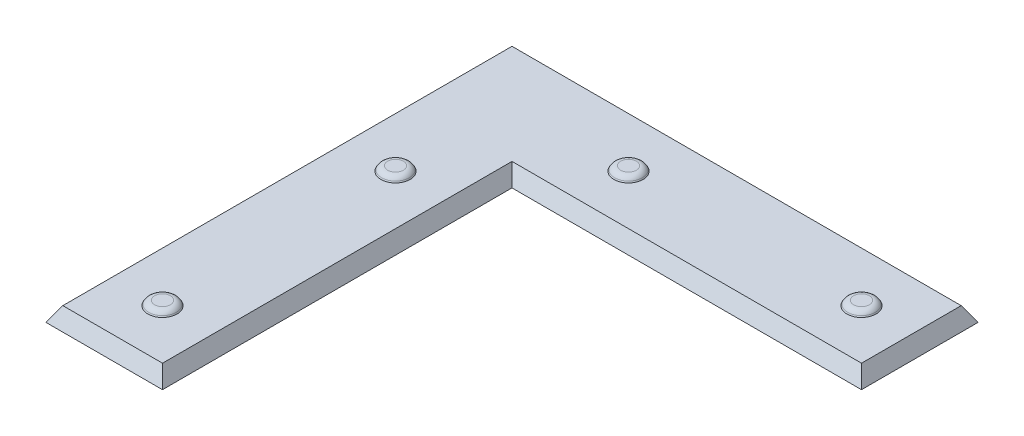
from build123d import *

# Parameters (mm, degrees)
BOSS_EXTRUDE1_DEPTH           = 0.79375
BOSS_EXTRUDE1_TAPER           = 30
SKETCH3_R                     = 0.79375
BOSS_EXTRUDE2_DEPTH           = 0.254
BOSS_EXTRUDE2_DRAFT           = 30
BOSS_EXTRUDE2_PROFILE_2_DEPTH = 0.254
BOSS_EXTRUDE2_PROFILE_2_DRAFT = 30
BOSS_EXTRUDE2_PROFILE_3_DEPTH = 0.254
BOSS_EXTRUDE2_PROFILE_3_DRAFT = 30
BOSS_EXTRUDE2_PROFILE_4_DEPTH = 0.254
BOSS_EXTRUDE2_PROFILE_4_DRAFT = 30
FILLET1_R                     = 0.381


with BuildPart() as part:
    # Sketch2 → Boss-Extrude1 (new body)
    with BuildSketch(Plane(origin=(0, 15.875, 0), x_dir=(1, 0, 0), z_dir=(0, 1, 0))):
        Polygon((-169.8625, 61.9125), (-163.5125, 61.9125), (-163.5125, 80.9625), (-144.4625, 80.9625), (-144.4625, 87.3125), (-169.8625, 87.3125), align=None)
    extrude(amount=BOSS_EXTRUDE1_DEPTH, taper=BOSS_EXTRUDE1_TAPER)


with BuildPart() as boss_extrude2_tool:
    # Sketch3 → Boss-Extrude2 (with draft: the straight prism first)
    with BuildSketch(Plane(origin=(0, 16.66875, 0), x_dir=(1, 0, 0), z_dir=(0, 1, 0))):
        with Locations((-166.6875, 65.0875)):
            Circle(SKETCH3_R)
    extrude(amount=BOSS_EXTRUDE2_DEPTH)
    # Boss-Extrude2: the draft: its side faces are tilted about the plane it starts from
    boss_extrude2_sides = [boss_extrude2_tool.faces().sort_by_distance(p)[0] for p in [
        (-167.48125, 16.79575, -65.0875),
    ]]
    draft(boss_extrude2_sides, Plane(origin=(0, 16.66875, 0), x_dir=(1, 0, 0), z_dir=(0, 1, 0)), BOSS_EXTRUDE2_DRAFT)


with BuildPart() as part_1:
    add(part.part)

    # Boss-Extrude2: add boss_extrude2_tool
    add(boss_extrude2_tool.part)


with BuildPart() as boss_extrude2_profile_2_tool:
    # Sketch3 → Boss-Extrude2 profile 2 (with draft: the straight prism first)
    with BuildSketch(Plane(origin=(0, 16.66875, 0), x_dir=(1, 0, 0), z_dir=(0, 1, 0))):
        with Locations((-166.6875, 77.7875)):
            Circle(SKETCH3_R)
    extrude(amount=BOSS_EXTRUDE2_PROFILE_2_DEPTH)
    # Boss-Extrude2 profile 2: the draft: its side faces are tilted about the plane it starts from
    boss_extrude2_profile_2_sides = [boss_extrude2_profile_2_tool.faces().sort_by_distance(p)[0] for p in [
        (-167.48125, 16.79575, -77.7875),
    ]]
    draft(boss_extrude2_profile_2_sides, Plane(origin=(0, 16.66875, 0), x_dir=(1, 0, 0), z_dir=(0, 1, 0)), BOSS_EXTRUDE2_PROFILE_2_DRAFT)


with BuildPart() as part_2:
    add(part_1.part)

    # Boss-Extrude2 profile 2: add boss_extrude2_profile_2_tool
    add(boss_extrude2_profile_2_tool.part)


with BuildPart() as boss_extrude2_profile_3_tool:
    # Sketch3 → Boss-Extrude2 profile 3 (with draft: the straight prism first)
    with BuildSketch(Plane(origin=(0, 16.66875, 0), x_dir=(1, 0, 0), z_dir=(0, 1, 0))):
        with Locations((-160.3375, 84.1375)):
            Circle(SKETCH3_R)
    extrude(amount=BOSS_EXTRUDE2_PROFILE_3_DEPTH)
    # Boss-Extrude2 profile 3: the draft: its side faces are tilted about the plane it starts from
    boss_extrude2_profile_3_sides = [boss_extrude2_profile_3_tool.faces().sort_by_distance(p)[0] for p in [
        (-161.13125, 16.79575, -84.1375),
    ]]
    draft(boss_extrude2_profile_3_sides, Plane(origin=(0, 16.66875, 0), x_dir=(1, 0, 0), z_dir=(0, 1, 0)), BOSS_EXTRUDE2_PROFILE_3_DRAFT)


with BuildPart() as part_3:
    add(part_2.part)

    # Boss-Extrude2 profile 3: add boss_extrude2_profile_3_tool
    add(boss_extrude2_profile_3_tool.part)


with BuildPart() as boss_extrude2_profile_4_tool:
    # Sketch3 → Boss-Extrude2 profile 4 (with draft: the straight prism first)
    with BuildSketch(Plane(origin=(0, 16.66875, 0), x_dir=(1, 0, 0), z_dir=(0, 1, 0))):
        with Locations((-147.6375, 84.1375)):
            Circle(SKETCH3_R)
    extrude(amount=BOSS_EXTRUDE2_PROFILE_4_DEPTH)
    # Boss-Extrude2 profile 4: the draft: its side faces are tilted about the plane it starts from
    boss_extrude2_profile_4_sides = [boss_extrude2_profile_4_tool.faces().sort_by_distance(p)[0] for p in [
        (-148.43125, 16.79575, -84.1375),
    ]]
    draft(boss_extrude2_profile_4_sides, Plane(origin=(0, 16.66875, 0), x_dir=(1, 0, 0), z_dir=(0, 1, 0)), BOSS_EXTRUDE2_PROFILE_4_DRAFT)


with BuildPart() as part_4:
    add(part_3.part)

    # Boss-Extrude2 profile 4: add boss_extrude2_profile_4_tool
    add(boss_extrude2_profile_4_tool.part)

    # Fillet1
    fillet1_edges = [part_4.edges().sort_by_distance(p)[0] for p in [
        (-148.284603032, 16.92275, -84.1375),
        (-160.984603032, 16.92275, -84.1375),
        (-167.334603032, 16.92275, -77.7875),
        (-167.334603032, 16.92275, -65.0875),
    ]]
    fillet(fillet1_edges, radius=FILLET1_R)


solid = part_4.part
